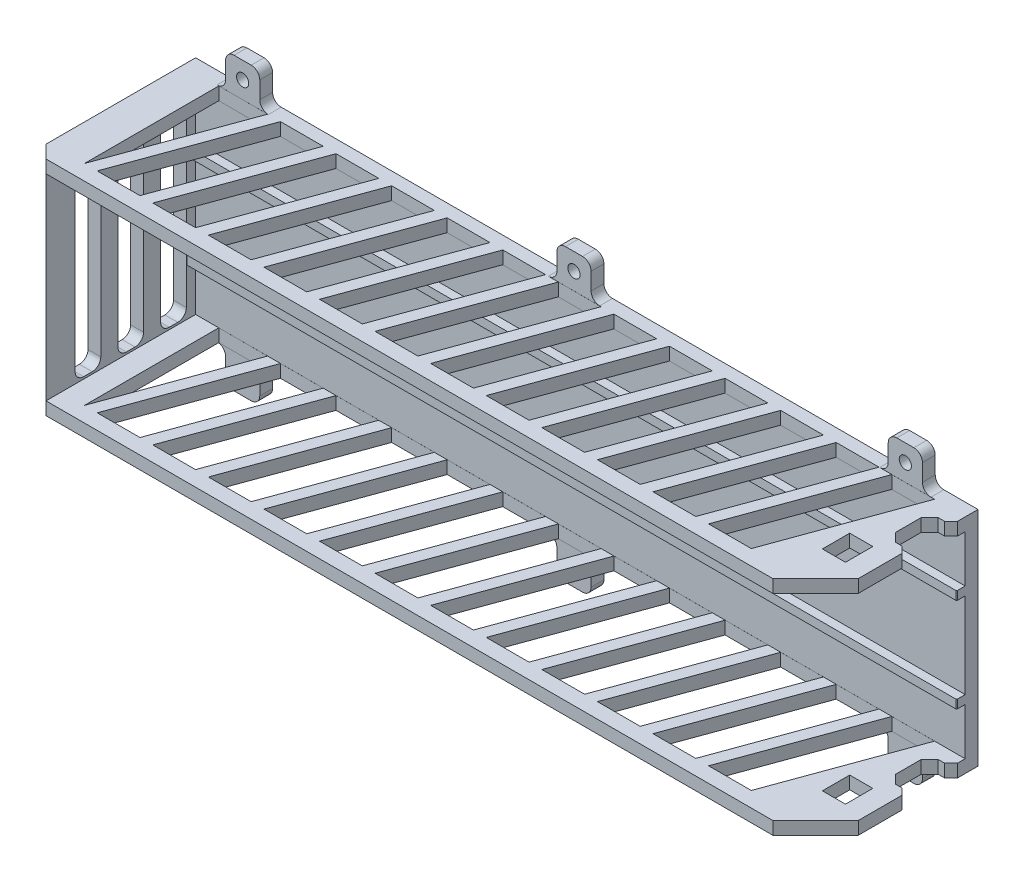
from build123d import *

# Parameters (mm, degrees)
SKETCH_1_W          = 186
SKETCH_1_H          = 52
SKETCH_1_W_2        = 180
SKETCH_1_H_2        = 46
EXTRUDE_1_DEPTH     = 35
SKETCH_2_W          = 186
SKETCH_2_H          = 52
EXTRUDE_2_DEPTH     = 3
SKETCH_3_W          = 38
SKETCH_3_H          = 52
CUT_EXTRUDE_1_DEPTH = 3
CUT_EXTRUDE_2_REACH = 192.602
SKETCH_4_W          = 5.4
SKETCH_4_H          = 6.4
CUT_EXTRUDE_START   = -52
CUT_EXTRUDE_3_DEPTH = 52
CHAMFER_1_SIZE      = 10
SKETCH_6_W          = 2
SKETCH_6_H          = 2
EXTRUDE_3_DEPTH     = 180
CHAMFER_2_SIZE      = 3
SKETCH_7_W          = 8
SKETCH_7_H          = 8
SKETCH_7_R          = 1.425
EXTRUDE_4_DEPTH     = 3
FILLET_START        = -4
FILLET_2_DEPTH      = 5
FILLET_START_2      = -3
FILLET_2_2_DEPTH    = 3
CUT_EXTRUDE_4_DEPTH = 3
CUT_EXTRUDE_5_DEPTH = 52
FILLET_3_DEPTH      = 5
FILLET_3_2_DEPTH    = 3


with BuildPart() as part:
    # 草图1 → 凸台-拉伸1 (new body)
    with BuildSketch(Plane.XY):
        with Locations((90, 23)):
            Rectangle(SKETCH_1_W, SKETCH_1_H)
        with Locations((90, 23)):
            Rectangle(SKETCH_1_W_2, SKETCH_1_H_2, mode=Mode.SUBTRACT)
    extrude(amount=EXTRUDE_1_DEPTH)

    # 草图2 → 凸台-拉伸2 (add)
    with BuildSketch(Plane(origin=(0, 0, 0), x_dir=(-1, 0, 0), z_dir=(0, 0, -1))):
        with Locations((-90, 23)):
            Rectangle(SKETCH_2_W, SKETCH_2_H)
    extrude(amount=EXTRUDE_2_DEPTH)

    # 草图3 → 切除-拉伸1 (cut)
    with BuildSketch(Plane(origin=(183, 0, 0), x_dir=(0, 0, -1), z_dir=(1, 0, 0))):
        with Locations((-16, 23)):
            Rectangle(SKETCH_3_W, SKETCH_3_H)
    extrude(amount=-CUT_EXTRUDE_1_DEPTH, mode=Mode.SUBTRACT)

    # 切除-拉伸2: up to this face of the body (flat: up to its plane)
    cut_extrude_2_end = Plane(part.part.faces().sort_by_distance((88.5, 49, 16))[0])
    # 草图4 → 切除-拉伸2 (cut, up to the picked face)
    with BuildSketch(Plane.XZ.offset(3), mode=Mode.PRIVATE) as cut_extrude_2_sk1:
        with Locations((172.5, 20)):
            Rectangle(SKETCH_4_W, SKETCH_4_H)
    cut_extrude_2_tool1 = split(extrude(cut_extrude_2_sk1.sketch, amount=-CUT_EXTRUDE_2_REACH, mode=Mode.PRIVATE), bisect_by=cut_extrude_2_end, keep=Keep.BOTH, mode=Mode.PRIVATE)
    add(cut_extrude_2_tool1.solids().sort_by(Axis((172.5, -3, 20), (0, 1, 0)))[0], mode=Mode.SUBTRACT)

    # 草图5 → 切除-拉伸3 (cut)
    with BuildSketch(Plane.XZ.offset(3).offset(CUT_EXTRUDE_START)):
        Polygon((172.850420295, 0.009381416), (161.412376883, 31.435147413), (151.412376883, 31.435147413), (162.850420295, 0.009381416), align=None)
        Polygon((159.850422792, 0.009381416), (148.41237938, 31.435147413), (138.41237938, 31.435147413), (149.850422792, 0.009381416), align=None)
        Polygon((146.85042529, 0.009381416), (135.412381878, 31.435147413), (125.412381878, 31.435147413), (136.85042529, 0.009381416), align=None)
        Polygon((133.850427788, 0.009381416), (122.412384376, 31.435147413), (112.412384376, 31.435147413), (123.850427788, 0.009381416), align=None)
        Polygon((120.850430286, 0.009381416), (109.412386874, 31.435147413), (99.412386874, 31.435147413), (110.850430286, 0.009381416), align=None)
        Polygon((107.850432784, 0.009381416), (96.412389372, 31.435147413), (86.412389372, 31.435147413), (97.850432784, 0.009381416), align=None)
        Polygon((94.850435282, 0.009381416), (83.41239187, 31.435147413), (73.41239187, 31.435147413), (84.850435282, 0.009381416), align=None)
        Polygon((81.85043778, 0.009381416), (70.412394368, 31.435147413), (60.412394368, 31.435147413), (71.85043778, 0.009381416), align=None)
        Polygon((68.850440277, 0.009381416), (57.412396866, 31.435147413), (47.412396866, 31.435147413), (58.850440277, 0.009381416), align=None)
        Polygon((55.850442775, 0.009381416), (44.412399363, 31.435147413), (34.412399363, 31.435147413), (45.850442775, 0.009381416), align=None)
        Polygon((42.850445273, 0.009381416), (31.412401861, 31.435147413), (21.412401861, 31.435147413), (32.850445273, 0.009381416), align=None)
        Polygon((29.850447771, 0.009381416), (18.412404359, 31.435147413), (8.412404359, 31.435147413), (19.850447771, 0.009381416), align=None)
        Polygon((16.850447771, 0.009381416), (5.412404359, 31.435147413), (5.412404359, 0), align=None)
    extrude(amount=CUT_EXTRUDE_3_DEPTH, mode=Mode.SUBTRACT)

    # 倒角1
    chamfer_1_edges = [part.edges().sort_by_distance(p)[0] for p in [
        (180, 47.5, 35),
        (180, -1.5, 35),
    ]]
    chamfer(chamfer_1_edges, length=CHAMFER_1_SIZE)

    # 草图6 → 凸台-拉伸3 (add)
    with BuildSketch(Plane(origin=(180, 0, 0), x_dir=(0, 0, -1), z_dir=(1, 0, 0))):
        with Locations((-1, 12)):
            Rectangle(SKETCH_6_W, SKETCH_6_H)
        with Locations((-1, 34)):
            Rectangle(SKETCH_6_W, SKETCH_6_H)
    extrude(amount=-EXTRUDE_3_DEPTH)

    # 倒角2
    chamfer_2_edges = [part.edges().sort_by_distance(p)[0] for p in [
        (-3, 23, 35),
    ]]
    chamfer(chamfer_2_edges, length=CHAMFER_2_SIZE - 0.0001)  # a hair under: the kernel refuses the full size

    # 草图7 → 凸台-拉伸4 (add)
    # profile 1 of 6: a face of its own
    with BuildSketch(Plane(origin=(0, 0, -3), x_dir=(-1, 0, 0), z_dir=(0, 0, -1))):
        with Locations((-166, 53)):
            Rectangle(SKETCH_7_W, SKETCH_7_H)
        with Locations((-166, 53)):
            Circle(SKETCH_7_R, mode=Mode.SUBTRACT)
    # profile 2 of 6: a face of its own
    with BuildSketch(Plane(origin=(0, 0, -3), x_dir=(-1, 0, 0), z_dir=(0, 0, -1))):
        with Locations((-11, 53)):
            Rectangle(SKETCH_7_W, SKETCH_7_H)
        with Locations((-11, 53)):
            Circle(SKETCH_7_R, mode=Mode.SUBTRACT)
    # profile 3 of 6: a face of its own
    with BuildSketch(Plane(origin=(0, 0, -3), x_dir=(-1, 0, 0), z_dir=(0, 0, -1))):
        with Locations((-88.5, 53)):
            Rectangle(SKETCH_7_W, SKETCH_7_H)
        with Locations((-88.5, 53)):
            Circle(SKETCH_7_R, mode=Mode.SUBTRACT)
    # profile 4 of 6: a face of its own
    with BuildSketch(Plane(origin=(0, 0, -3), x_dir=(-1, 0, 0), z_dir=(0, 0, -1))):
        with Locations((-11, -7)):
            Rectangle(SKETCH_7_W, SKETCH_7_H)
        with Locations(Location((-11, -7, 0), (0, 0, 180))):
            Circle(SKETCH_7_R, mode=Mode.SUBTRACT)
    # profile 5 of 6: a face of its own
    with BuildSketch(Plane(origin=(0, 0, -3), x_dir=(-1, 0, 0), z_dir=(0, 0, -1))):
        with Locations((-88.5, -7)):
            Rectangle(SKETCH_7_W, SKETCH_7_H)
        with Locations(Location((-88.5, -7, 0), (0, 0, 180))):
            Circle(SKETCH_7_R, mode=Mode.SUBTRACT)
    # profile 6 of 6: a face of its own
    with BuildSketch(Plane(origin=(0, 0, -3), x_dir=(-1, 0, 0), z_dir=(0, 0, -1))):
        with Locations((-166, -7)):
            Rectangle(SKETCH_7_W, SKETCH_7_H)
        with Locations(Location((-166, -7, 0), (0, 0, 180))):
            Circle(SKETCH_7_R, mode=Mode.SUBTRACT)
    extrude(amount=-EXTRUDE_4_DEPTH)

    # 圆角2: read off the stored shape, not the designer's step
    # 圆角2 outline → 圆角2 (cut)
    with BuildSketch(Plane.XY.offset(FILLET_START)):
        with BuildLine():
            Line((7, 57), (7, 55))
            ThreePointArc((7, 55), (7.585786438, 56.414213562), (9, 57))
            Line((9, 57), (7, 57))
        make_face()
        with BuildLine():
            Line((15, 57), (13, 57))
            ThreePointArc((13, 57), (14.414213562, 56.414213562), (15, 55))
            Line((15, 55), (15, 57))
        make_face()
        with BuildLine():
            Line((84.5, 57), (84.5, 55))
            ThreePointArc((84.5, 55), (85.085786438, 56.414213562), (86.5, 57))
            Line((86.5, 57), (84.5, 57))
        make_face()
        with BuildLine():
            Line((92.5, 57), (90.5, 57))
            ThreePointArc((90.5, 57), (91.914213562, 56.414213562), (92.5, 55))
            Line((92.5, 55), (92.5, 57))
        make_face()
        with BuildLine():
            Line((162, 57), (162, 55))
            ThreePointArc((162, 55), (162.585786438, 56.414213562), (164, 57))
            Line((164, 57), (162, 57))
        make_face()
        with BuildLine():
            Line((170, 57), (168, 57))
            ThreePointArc((168, 57), (169.414213562, 56.414213562), (170, 55))
            Line((170, 55), (170, 57))
        make_face()
    extrude(amount=FILLET_2_DEPTH, mode=Mode.SUBTRACT)

    # Fillet 2 2 outline → Fillet 2 2 (add)
    with BuildSketch(Plane.XY.offset(FILLET_START_2)):
        with BuildLine():
            ThreePointArc((162, 51), (161.414213562, 49.585786438), (160, 49))
            Line((160, 49), (162, 49))
            Line((162, 49), (162, 51))
        make_face()
        with BuildLine():
            ThreePointArc((84.5, 51), (83.914213562, 49.585786438), (82.5, 49))
            Line((82.5, 49), (84.5, 49))
            Line((84.5, 49), (84.5, 51))
        make_face()
        with BuildLine():
            Line((7, 49), (7, 51))
            ThreePointArc((7, 51), (6.414213562, 49.585786438), (5, 49))
            Line((5, 49), (7, 49))
        make_face()
        with BuildLine():
            Line((15, 51), (15, 49))
            Line((15, 49), (17, 49))
            ThreePointArc((17, 49), (15.585786438, 49.585786438), (15, 51))
        make_face()
        with BuildLine():
            Line((92.5, 51), (92.5, 49))
            Line((92.5, 49), (94.5, 49))
            ThreePointArc((94.5, 49), (93.085786438, 49.585786438), (92.5, 51))
        make_face()
        with BuildLine():
            Line((170, 51), (170, 49))
            Line((170, 49), (172, 49))
            ThreePointArc((172, 49), (170.585786438, 49.585786438), (170, 51))
        make_face()
    extrude(amount=FILLET_2_2_DEPTH)

    # 草图8 → 切除-拉伸4 (cut)
    with BuildSketch(Plane.ZY.offset(3)):
        with BuildLine():
            Line((4.183542591, 45.5), (6.183542591, 45.5))
            ThreePointArc((6.183542591, 45.5), (7.597756153, 44.914213562), (8.183542591, 43.5))
            Line((8.183542591, 43.5), (8.183542591, 2.5))
            ThreePointArc((8.183542591, 2.5), (7.597756153, 1.085786438), (6.183542591, 0.5))
            Line((6.183542591, 0.5), (4.183542591, 0.5))
            ThreePointArc((4.183542591, 0.5), (2.769329028, 1.085786438), (2.183542591, 2.5))
            Line((2.183542591, 2.5), (2.183542591, 43.5))
            ThreePointArc((2.183542591, 43.5), (2.769329028, 44.914213562), (4.183542591, 45.5))
        make_face()
        with BuildLine():
            Line((12.183542591, 43.5), (12.183542591, 2.5))
            ThreePointArc((12.183542591, 2.5), (12.769329028, 1.085786438), (14.183542591, 0.5))
            Line((14.183542591, 0.5), (16.183542591, 0.5))
            ThreePointArc((16.183542591, 0.5), (17.597756153, 1.085786438), (18.183542591, 2.5))
            Line((18.183542591, 2.5), (18.183542591, 43.5))
            ThreePointArc((18.183542591, 43.5), (17.597756153, 44.914213562), (16.183542591, 45.5))
            Line((16.183542591, 45.5), (14.183542591, 45.5))
            ThreePointArc((14.183542591, 45.5), (12.769329028, 44.914213562), (12.183542591, 43.5))
        make_face()
        with BuildLine():
            Line((22.183542591, 43.5), (22.183542591, 2.5))
            ThreePointArc((22.183542591, 2.5), (22.769329028, 1.085786438), (24.183542591, 0.5))
            Line((24.183542591, 0.5), (26.183542591, 0.5))
            ThreePointArc((26.183542591, 0.5), (27.597756153, 1.085786438), (28.183542591, 2.5))
            Line((28.183542591, 2.5), (28.183542591, 43.5))
            ThreePointArc((28.183542591, 43.5), (27.597756153, 44.914213562), (26.183542591, 45.5))
            Line((26.183542591, 45.5), (24.183542591, 45.5))
            ThreePointArc((24.183542591, 45.5), (22.769329028, 44.914213562), (22.183542591, 43.5))
        make_face()
    extrude(amount=-CUT_EXTRUDE_4_DEPTH, mode=Mode.SUBTRACT)

    # 草图9 → 切除-拉伸5 (cut)
    with BuildSketch(Plane.XZ.offset(3).offset(CUT_EXTRUDE_START)):
        Polygon((178.5, 13.3), (177, 13.3), (175, 11.3), (175, 5.3), (177, 3.3), (178.5, 3.3), (180, 1.8), (180, 14.8), align=None)
    extrude(amount=CUT_EXTRUDE_5_DEPTH, mode=Mode.SUBTRACT)

    # 圆角3: read off the stored shape, not the designer's step
    # 圆角3 outline → 圆角3 (cut)
    with BuildSketch(Plane.XY.offset(FILLET_START)):
        with BuildLine():
            ThreePointArc((9, -11), (7.585786438, -10.414213562), (7, -9))
            Line((7, -9), (7, -11))
            Line((7, -11), (9, -11))
        make_face()
        with BuildLine():
            ThreePointArc((15, -9), (14.414213562, -10.414213562), (13, -11))
            Line((13, -11), (15, -11))
            Line((15, -11), (15, -9))
        make_face()
        with BuildLine():
            ThreePointArc((86.5, -11), (85.085786438, -10.414213562), (84.5, -9))
            Line((84.5, -9), (84.5, -11))
            Line((84.5, -11), (86.5, -11))
        make_face()
        with BuildLine():
            ThreePointArc((92.5, -9), (91.914213562, -10.414213562), (90.5, -11))
            Line((90.5, -11), (92.5, -11))
            Line((92.5, -11), (92.5, -9))
        make_face()
        with BuildLine():
            ThreePointArc((164, -11), (162.585786438, -10.414213562), (162, -9))
            Line((162, -9), (162, -11))
            Line((162, -11), (164, -11))
        make_face()
        with BuildLine():
            ThreePointArc((170, -9), (169.414213562, -10.414213562), (168, -11))
            Line((168, -11), (170, -11))
            Line((170, -11), (170, -9))
        make_face()
    extrude(amount=FILLET_3_DEPTH, mode=Mode.SUBTRACT)

    # Fillet 3 2 outline → Fillet 3 2 (add)
    with BuildSketch(Plane.XY.offset(FILLET_START_2)):
        with BuildLine():
            Line((7, -3), (5, -3))
            ThreePointArc((5, -3), (6.414213562, -3.585786438), (7, -5))
            Line((7, -5), (7, -3))
        make_face()
        with BuildLine():
            Line((162, -3), (160, -3))
            ThreePointArc((160, -3), (161.414213562, -3.585786438), (162, -5))
            Line((162, -5), (162, -3))
        make_face()
        with BuildLine():
            Line((84.5, -3), (82.5, -3))
            ThreePointArc((82.5, -3), (83.914213562, -3.585786438), (84.5, -5))
            Line((84.5, -5), (84.5, -3))
        make_face()
        with BuildLine():
            Line((17, -3), (15, -3))
            Line((15, -3), (15, -5))
            ThreePointArc((15, -5), (15.585786438, -3.585786438), (17, -3))
        make_face()
        with BuildLine():
            Line((94.5, -3), (92.5, -3))
            Line((92.5, -3), (92.5, -5))
            ThreePointArc((92.5, -5), (93.085786438, -3.585786438), (94.5, -3))
        make_face()
        with BuildLine():
            Line((172, -3), (170, -3))
            Line((170, -3), (170, -5))
            ThreePointArc((170, -5), (170.585786438, -3.585786438), (172, -3))
        make_face()
    extrude(amount=FILLET_3_2_DEPTH)


solid = part.part
